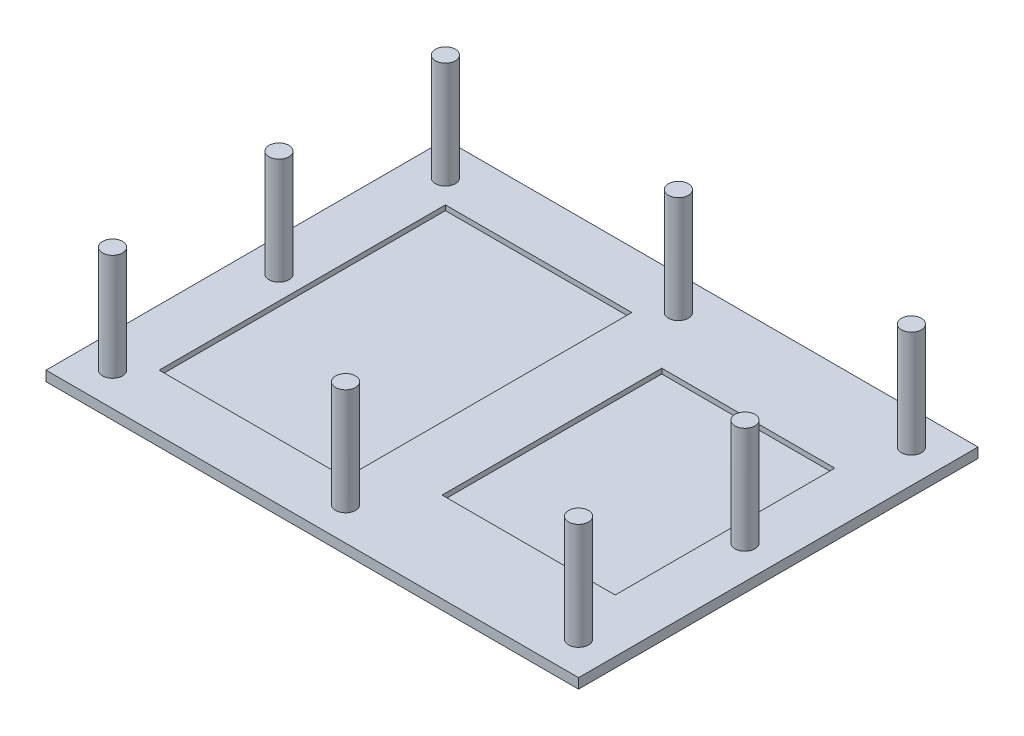
from build123d import *

# Parameters (mm, degrees)
SKETCH1_W           = 160
SKETCH1_H           = 120
BOSS_EXTRUDE1_DEPTH = 3
SKETCH2_R           = 3
BOSS_EXTRUDE2_DEPTH = 32
SKETCH3_W           = 56
SKETCH3_H           = 86
CUT_EXTRUDE1_DEPTH  = 1.5
SKETCH5_W           = 52
SKETCH5_H           = 66
CUT_EXTRUDE2_DEPTH  = 1.5


with BuildPart() as part:
    # Sketch1 → Boss-Extrude1 (new body)
    with BuildSketch(Plane(origin=(0, 0, 0), x_dir=(1, 0, 0), z_dir=(0, 1, 0))):
        Rectangle(SKETCH1_W, SKETCH1_H)
    extrude(amount=BOSS_EXTRUDE1_DEPTH)

    # Sketch2 → Boss-Extrude2 (add)
    with BuildSketch(Plane(origin=(0, 3, 0), x_dir=(1, 0, 0), z_dir=(0, 1, 0))):
        with Locations((-70, 50)):
            Circle(SKETCH2_R)
        with Locations((0, 50)):
            Circle(SKETCH2_R)
        with Locations((70, 50)):
            Circle(SKETCH2_R)
        with Locations((-70, 0)):
            Circle(SKETCH2_R)
        with Locations((70, 0)):
            Circle(SKETCH2_R)
        with Locations((-70, -50)):
            Circle(SKETCH2_R)
        with Locations((0, -50)):
            Circle(SKETCH2_R)
        with Locations((70, -50)):
            Circle(SKETCH2_R)
    extrude(amount=BOSS_EXTRUDE2_DEPTH)

    # Sketch3 → Cut-Extrude1 (cut)
    with BuildSketch(Plane(origin=(0, 3, 0), x_dir=(1, 0, 0), z_dir=(0, 1, 0))):
        with Locations((-35, 0)):
            Rectangle(SKETCH3_W, SKETCH3_H)
    extrude(amount=-CUT_EXTRUDE1_DEPTH, mode=Mode.SUBTRACT)

    # Sketch5 → Cut-Extrude2 (cut)
    with BuildSketch(Plane(origin=(0, 3, 0), x_dir=(1, 0, 0), z_dir=(0, 1, 0))):
        with Locations((38, 0)):
            Rectangle(SKETCH5_W, SKETCH5_H)
    extrude(amount=-CUT_EXTRUDE2_DEPTH, mode=Mode.SUBTRACT)


solid = part.part
